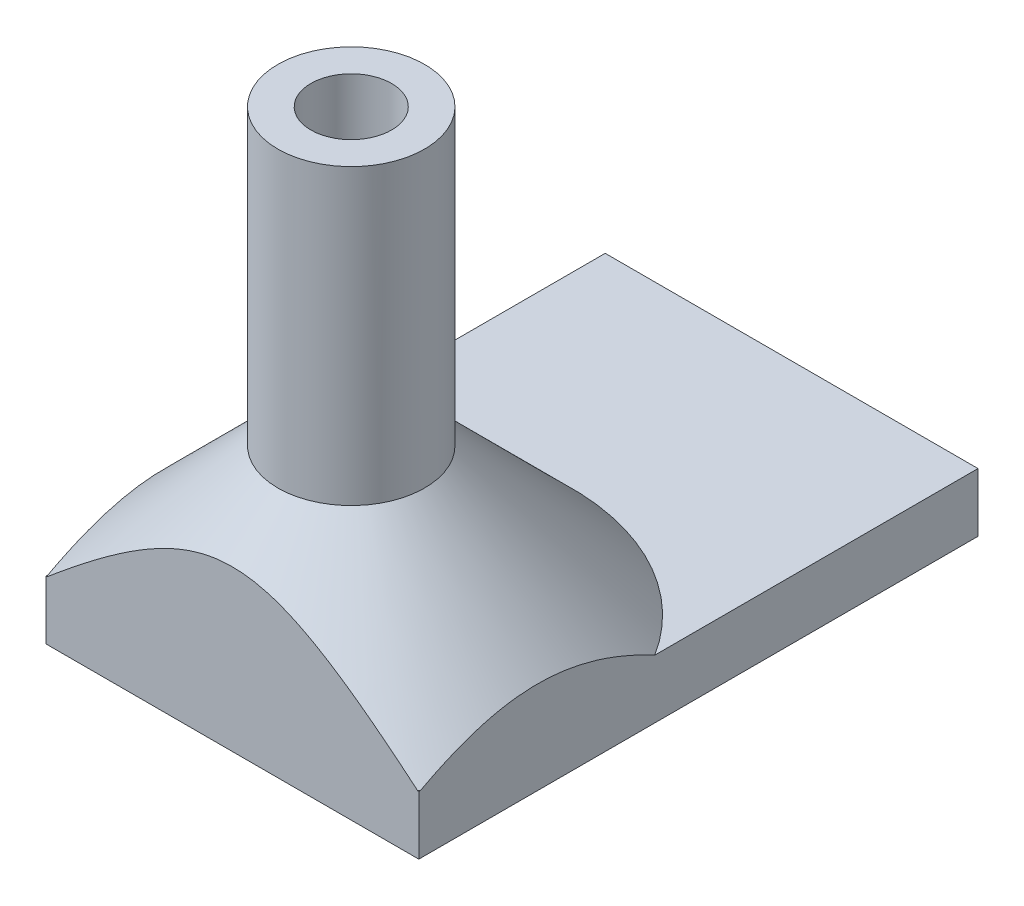
from build123d import *

# Parameters (mm, degrees)
SKETCH1_W           = 25.4
SKETCH1_H           = 38.1
BOSS_EXTRUDE1_DEPTH = 4
SKETCH2_R           = 5
BOSS_EXTRUDE2_DEPTH = 30
SKETCH3_R           = 2.75
CUT_EXTRUDE1_DEPTH  = 40
CHAMFER1_SIZE       = 10


with BuildPart() as part:
    # Sketch1 → Boss-Extrude1 (new body)
    with BuildSketch(Plane(origin=(0, 0, 0), x_dir=(1, 0, 0), z_dir=(0, 1, 0))):
        Rectangle(SKETCH1_W, SKETCH1_H)
    extrude(amount=BOSS_EXTRUDE1_DEPTH)

    # Sketch2 → Boss-Extrude2 (add)
    with BuildSketch(Plane(origin=(0, 4, 0), x_dir=(1, 0, 0), z_dir=(0, 1, 0))):
        with Locations(Location((0, -10.9531854, 0), (0, 0, 270))):
            Circle(SKETCH2_R)
    extrude(amount=BOSS_EXTRUDE2_DEPTH)

    # Sketch3 → Cut-Extrude1 (cut)
    with BuildSketch(Plane(origin=(0, 34, 0), x_dir=(1, 0, 0), z_dir=(0, 1, 0))):
        with Locations(Location((0, -10.9531854, 0), (0, 0, 270))):
            Circle(SKETCH3_R)
    extrude(amount=-CUT_EXTRUDE1_DEPTH, mode=Mode.SUBTRACT)

    # Chamfer1
    # the kernel refuses this chamfer: 10 mm, written as the material it adds along each edge
    with BuildSketch(Plane(origin=(0, 4, 10.9531854), x_dir=(0, 0, 1), z_dir=(-1, 0, 0))) as chamfer1_piece_1_section:
        Polygon((5 + CHAMFER1_SIZE, 0), (5, CHAMFER1_SIZE), (5, 0), align=None)
    chamfer1_piece_1 = revolve(axis=Axis((0, 4, 10.9531854), (0, 1, 0)), mode=Mode.PRIVATE)
    chamfer1_piece_1 = split(chamfer1_piece_1, bisect_by=Plane(origin=(-12.7, 8.904804992, 1.048380408), z_dir=(1, 0, 0)), keep=Keep.TOP, mode=Mode.PRIVATE)
    chamfer1_piece_1 = split(chamfer1_piece_1, bisect_by=Plane(origin=(12.7, 8.904804992, 1.048380408), z_dir=(-1, 0, 0)), keep=Keep.TOP, mode=Mode.PRIVATE)
    chamfer1_piece_1 = split(chamfer1_piece_1, bisect_by=Plane(origin=(0, 8.904804992, 19.05), z_dir=(0, 0, -1)), keep=Keep.TOP, mode=Mode.PRIVATE)
    add(chamfer1_piece_1)


solid = part.part
